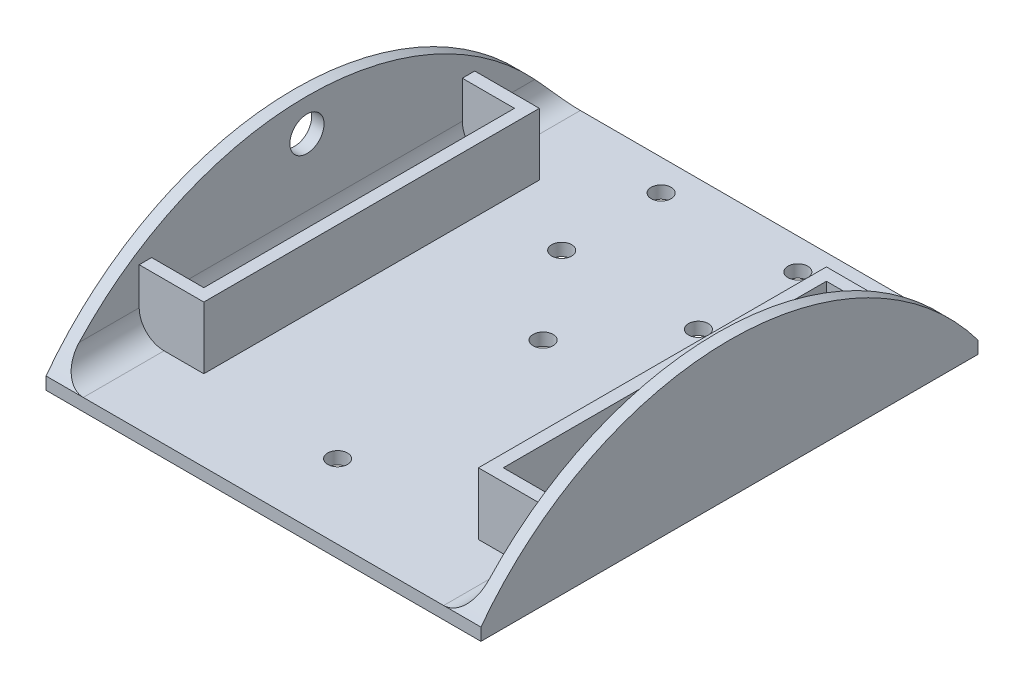
from build123d import *

# Parameters (mm, degrees)
SKETCH1_W           = 88.9
SKETCH1_H           = 101.6
BASE_EXTRUDE_DEPTH  = 2.54
WALL_EXTRUDE_DEPTH  = 2.54
CUT_EXTRUDE1_REACH  = 139.864
SKETCH3_R           = 3.4925
FILLET2_R           = 5.08
SKETCH4_R           = 2.032
CUT_EXTRUDE2_DEPTH  = 138.371503752
SKETCH5_W           = 2.54
SKETCH5_H           = 2.54
SKETCH5_W_2         = 5.08
SKETCH5_W_3         = 5.588
BOSS_EXTRUDE1_DEPTH = 12.7


with BuildPart() as part:
    # Sketch1 → Base Extrude (new body)
    with BuildSketch(Plane(origin=(0, 0, 0), x_dir=(1, 0, 0), z_dir=(0, 1, 0))):
        with Locations((44.45, 50.8)):
            Rectangle(SKETCH1_W, SKETCH1_H)
    extrude(amount=BASE_EXTRUDE_DEPTH)

    # Sketch2 → Wall Extrude (add)
    with BuildSketch(Plane(origin=(88.9, 0, 0), x_dir=(0, 0, -1), z_dir=(1, 0, 0))):
        with BuildLine():
            Line((101.6, 2.54), (101.6, 0))
            Line((101.6, 0), (0, 0))
            Line((0, 0), (0, 2.54))
            ThreePointArc((0, 2.54), (50.8, 27.94), (101.6, 2.54))
        make_face()
    wall_extrude = extrude(amount=-WALL_EXTRUDE_DEPTH)

    # Wall Mirror: Wall Extrude across plane
    add(wall_extrude.mirror(Plane(origin=(44.45, 0, 0), x_dir=(0, 0, 1), z_dir=(1, 0, 0))))

    # Sketch3 → Cut-Extrude1 (cut, up to next)
    with BuildSketch(Plane.ZY, mode=Mode.PRIVATE) as cut_extrude1_sk1:
        with Locations((-50.8, 21.2725)):
            Circle(SKETCH3_R)
    cut_extrude1_tool1 = extrude(cut_extrude1_sk1.sketch, amount=-CUT_EXTRUDE1_REACH, mode=Mode.PRIVATE) & part.part
    add(cut_extrude1_tool1.solids().sort_by_distance((0, 21.2725, -50.8))[0], mode=Mode.SUBTRACT)

    # Fillet2
    # the kernel refuses this fillet: 5.08 mm, written as the material it adds along each edge
    with BuildSketch(Plane(origin=(86.36, 2.54, -101.6), x_dir=(-1, 0, 0), z_dir=(0, 0, 1))) as fillet2_piece_1_section:
        with BuildLine():
            CenterArc((FILLET2_R, -FILLET2_R), FILLET2_R, 90, 90)
            Line((0, -FILLET2_R), (0, 0))
            Line((0, 0), (FILLET2_R, 0))
        make_face()
    fillet2_piece_1 = extrude(amount=101.6, mode=Mode.PRIVATE)
    fillet2_piece_1 = fillet2_piece_1 & Plane(origin=(85.198656014, -35.56, -50.8), x_dir=(0, 0.6000000000000003, 0.7999999999999998), z_dir=(1, 0, 0)) * Cylinder(63.5, 224, mode=Mode.PRIVATE)
    add(fillet2_piece_1)
    with BuildSketch(Plane(origin=(2.54, 2.54, -101.6), x_dir=(1, 0, 0), z_dir=(0, 0, 1))) as fillet2_piece_2_section:
        with BuildLine():
            CenterArc((FILLET2_R, FILLET2_R), FILLET2_R, 180, 90)
            Line((0, FILLET2_R), (0, 0))
            Line((0, 0), (FILLET2_R, 0))
        make_face()
    fillet2_piece_2 = extrude(amount=101.6, mode=Mode.PRIVATE)
    fillet2_piece_2 = fillet2_piece_2 & Plane(origin=(3.701343986, -35.56, -50.8), x_dir=(0, 0.6000000000000003, 0.7999999999999998), z_dir=(-1, 0, 0)) * Cylinder(63.5, 224, mode=Mode.PRIVATE)
    add(fillet2_piece_2)

    # Sketch4 → Cut-Extrude2 (cut, through all)
    with BuildSketch(Plane(origin=(0, 2.54, 0), x_dir=(1, 0, 0), z_dir=(0, 1, 0))):
        with Locations(Location((44.45, 57.15, 0), (0, 0, 270))):
            Circle(SKETCH4_R)
        with Locations(Location((44.45, 15.15, 0), (0, 0, 270))):
            Circle(SKETCH4_R)
        with Locations(Location((58.42, 74.93, 0), (0, 0, 270))):
            Circle(SKETCH4_R)
        with Locations(Location((58.42, 95.25, 0), (0, 0, 270))):
            Circle(SKETCH4_R)
        with Locations(Location((30.48, 74.93, 0), (0, 0, 90))):
            Circle(SKETCH4_R)
        with Locations(Location((30.48, 95.25, 0), (0, 0, 90))):
            Circle(SKETCH4_R)
    extrude(amount=-CUT_EXTRUDE2_DEPTH, mode=Mode.SUBTRACT)

    # Sketch5 → Boss-Extrude1 (add)
    with BuildSketch(Plane(origin=(0, 2.54, 0), x_dir=(1, 0, 0), z_dir=(0, 1, 0))):
        with Locations((87.63, 50.8)):
            Rectangle(SKETCH5_W, SKETCH5_H)
        Polygon((13.208, 82.55), (13.208, 19.05), (7.62, 19.05), (7.62, 16.51), (15.748, 16.51), (15.748, 85.09), (7.62, 85.09), (7.62, 82.55), align=None)
        with Locations((5.08, 17.78)):
            Rectangle(SKETCH5_W_2, SKETCH5_H)
        with Locations((5.08, 83.82)):
            Rectangle(SKETCH5_W_2, SKETCH5_H)
        Polygon((81.28, 83.82), (81.28, 86.36), (73.152, 86.36), (73.152, 52.07), (75.692, 52.07), (75.692, 83.82), align=None)
        Polygon((75.692, 49.53), (73.152, 49.53), (73.152, 15.24), (81.28, 15.24), (81.28, 17.78), (75.692, 17.78), align=None)
        with Locations((83.82, 50.8)):
            Rectangle(SKETCH5_W_2, SKETCH5_H)
        with Locations((78.486, 50.8)):
            Rectangle(SKETCH5_W_3, SKETCH5_H)
        with Locations((74.422, 50.8)):
            Rectangle(SKETCH5_W, SKETCH5_H)
        with Locations((83.82, 85.09)):
            Rectangle(SKETCH5_W_2, SKETCH5_H)
        with Locations((83.82, 16.51)):
            Rectangle(SKETCH5_W_2, SKETCH5_H)
    extrude(amount=BOSS_EXTRUDE1_DEPTH)


solid = part.part
